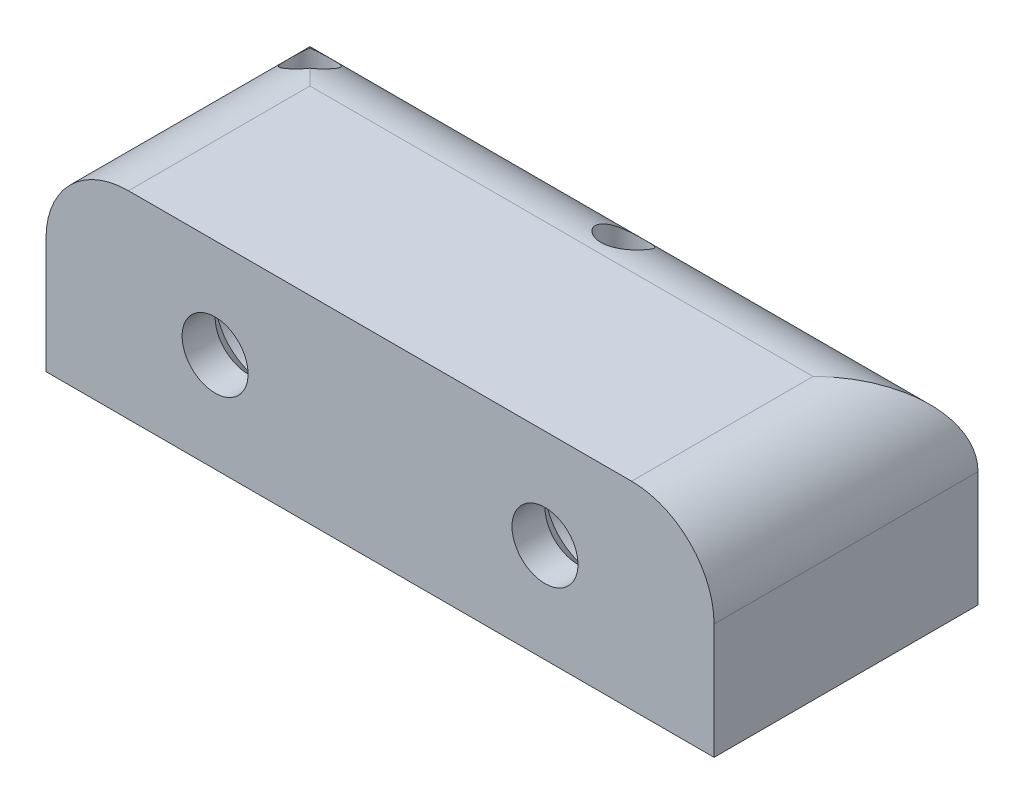
from build123d import *

# Parameters (mm, degrees)
SKETCH1_W           = 40.5
SKETCH1_H           = 16
SKETCH1_R           = 1.35
BOSS_EXTRUDE1_DEPTH = 12
BOSS_EXTRUDE2_START = 2
BOSS_EXTRUDE2_DEPTH = 10
SKETCH2_R           = 3.5
SKETCH2_R_2         = 2
CUT_EXTRUDE1_DEPTH  = 13
SKETCH2_3_R         = 2
CUT_EXTRUDE2_DEPTH  = 29.461596933
CHAMFER1_SIZE       = 1
FILLET1_R           = 5


with BuildPart() as part:
    # Sketch1 → Boss-Extrude1 (new body)
    with BuildSketch(Plane(origin=(0, 0, 0), x_dir=(1, 0, 0), z_dir=(0, 1, 0))):
        Rectangle(SKETCH1_W, SKETCH1_H)
        with Locations(Location((-17.25, 5, 0), (0, 0, 270))):
            Circle(SKETCH1_R, mode=Mode.SUBTRACT)
        with BuildLine():
            Line((-14.421572875, 6), (-1.078427125, 6))
            ThreePointArc((-1.078427125, 6), (1.75, 2), (4.578427125, 6))
            Line((4.578427125, 6), (18.25, 6))
            Line((18.25, 6), (18.25, -6))
            Line((18.25, -6), (-18.25, -6))
            Line((-18.25, -6), (-18.25, 2.171572875))
            ThreePointArc((-18.25, 2.171572875), (-15.128679656, 2.878679656), (-14.421572875, 6))
        make_face(mode=Mode.SUBTRACT)
        with Locations(Location((1.75, 5, 0), (0, 0, 270))):
            Circle(SKETCH1_R, mode=Mode.SUBTRACT)
    extrude(amount=BOSS_EXTRUDE1_DEPTH)

    # Sketch1<3> → Boss-Extrude2 (add)
    with BuildSketch(Plane(origin=(0, 0, 0), x_dir=(1, 0, 0), z_dir=(0, 1, 0)).offset(BOSS_EXTRUDE2_START)):
        with BuildLine():
            ThreePointArc((-14.25, 5), (-15.517949192, 2.550510257), (-18.25, 2.171572875))
            Line((-18.25, 2.171572875), (-18.25, -6))
            Line((-18.25, -6), (18.25, -6))
            Line((18.25, -6), (18.25, 6))
            Line((18.25, 6), (4.578427125, 6))
            ThreePointArc((4.578427125, 6), (4.706795679, 5.507305936), (4.75, 5))
            ThreePointArc((4.75, 5), (1.242694064, 2.043204321), (-1.078427125, 6))
            Line((-1.078427125, 6), (-14.421572875, 6))
            ThreePointArc((-14.421572875, 6), (-14.293204321, 5.507305936), (-14.25, 5))
        make_face()
    extrude(amount=BOSS_EXTRUDE2_DEPTH)

    # Sketch2 → Cut-Extrude1 (cut)
    # profile 1 of 4: a face of its own
    with BuildSketch(Plane(origin=(0, 0, -8), x_dir=(-1, 0, 0), z_dir=(0, 0, -1))):
        with Locations((-10, 6)):
            Circle(SKETCH2_R)
        with Locations((-10, 6)):
            Circle(SKETCH2_R_2, mode=Mode.SUBTRACT)
    # profile 2 of 4: a face of its own
    with BuildSketch(Plane(origin=(0, 0, -8), x_dir=(-1, 0, 0), z_dir=(0, 0, -1))):
        with Locations((-10, 6)):
            Circle(SKETCH2_R_2)
    # profile 3 of 4: a face of its own
    with BuildSketch(Plane(origin=(0, 0, -8), x_dir=(-1, 0, 0), z_dir=(0, 0, -1))):
        with Locations((10, 6)):
            Circle(SKETCH2_R)
        with Locations((10, 6)):
            Circle(SKETCH2_R_2, mode=Mode.SUBTRACT)
    # profile 4 of 4: a face of its own
    with BuildSketch(Plane(origin=(0, 0, -8), x_dir=(-1, 0, 0), z_dir=(0, 0, -1))):
        with Locations((10, 6)):
            Circle(SKETCH2_R_2)
    extrude(amount=-CUT_EXTRUDE1_DEPTH, mode=Mode.SUBTRACT)

    # Sketch2<3> → Cut-Extrude2 (cut, through all)
    with BuildSketch(Plane(origin=(0, 0, -8), x_dir=(-1, 0, 0), z_dir=(0, 0, -1))):
        with Locations((-10, 6)):
            Circle(SKETCH2_3_R)
        with Locations((10, 6)):
            Circle(SKETCH2_3_R)
    extrude(amount=-CUT_EXTRUDE2_DEPTH, mode=Mode.SUBTRACT)

    # Chamfer1
    chamfer1_edges = [part.edges().sort_by_distance(p)[0] for p in [
        (12, 6, 5),
        (-8, 6, 5),
    ]]
    chamfer(chamfer1_edges, length=CHAMFER1_SIZE)

    # Fillet1
    # the kernel refuses this fillet: 5 mm, written as the material it takes off along each edge
    with BuildSketch(Plane(origin=(32.75, 12, -8), x_dir=(0, -1, 0), z_dir=(-1, 0, 0))) as fillet1_piece_1:
        with BuildLine():
            CenterArc((FILLET1_R, FILLET1_R), FILLET1_R, 180, 90)
            Line((0, FILLET1_R), (0, 0))
            Line((0, 0), (FILLET1_R, 0))
        make_face()
    extrude(amount=65.5, mode=Mode.SUBTRACT)
    with BuildSketch(Plane(origin=(20.25, 12, 20.5), x_dir=(0, -1, 0), z_dir=(0, 0, -1))) as fillet1_piece_2:
        with BuildLine():
            CenterArc((FILLET1_R, FILLET1_R), FILLET1_R, 180, 90)
            Line((0, FILLET1_R), (0, 0))
            Line((0, 0), (FILLET1_R, 0))
        make_face()
    extrude(amount=41, mode=Mode.SUBTRACT)
    with BuildSketch(Plane(origin=(-20.25, 12, -20.5), x_dir=(1, 0, 0), z_dir=(0, 0, 1))) as fillet1_piece_3:
        with BuildLine():
            CenterArc((FILLET1_R, -FILLET1_R), FILLET1_R, 90, 90)
            Line((0, -FILLET1_R), (0, 0))
            Line((0, 0), (FILLET1_R, 0))
        make_face()
    extrude(amount=41, mode=Mode.SUBTRACT)


solid = part.part
